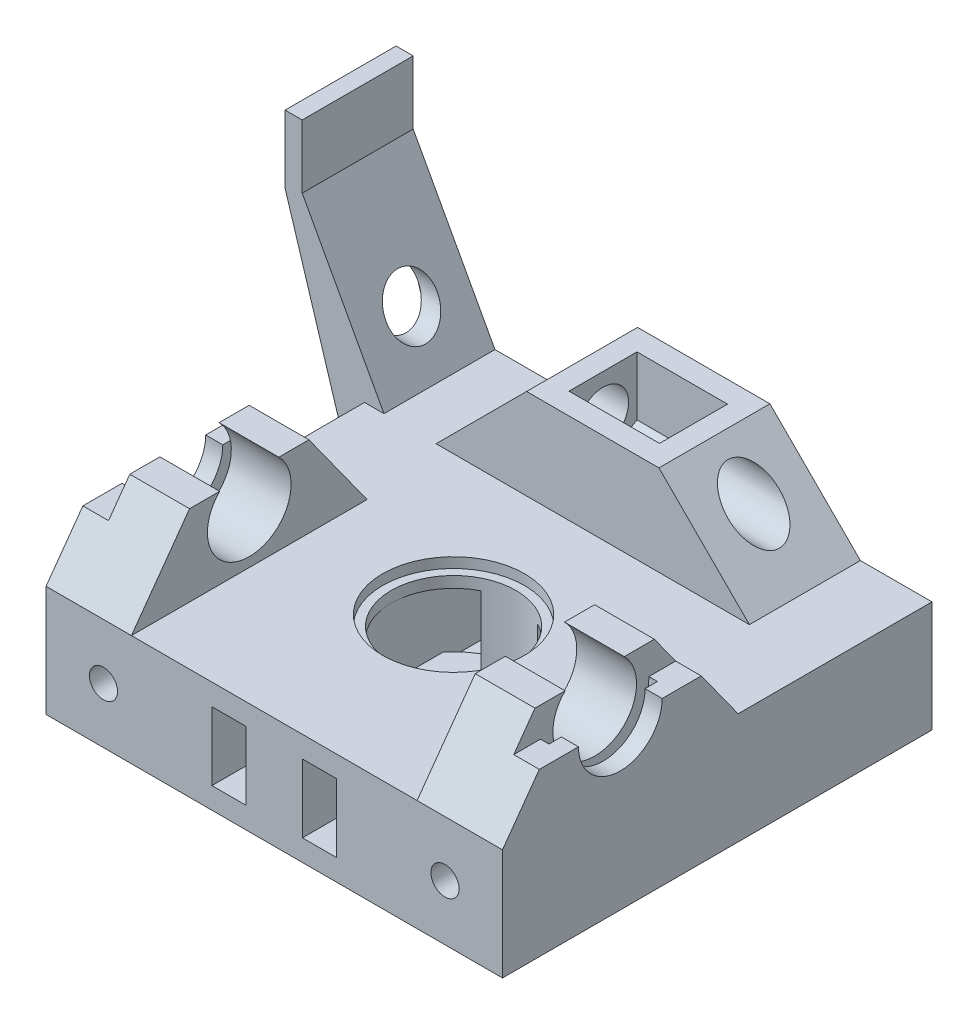
from build123d import *

# Parameters (mm, degrees)
SKETCH1_W           = 53.4573
SKETCH1_H           = 13
SKETCH1_R           = 4.2
BOSS_EXTRUDE1_DEPTH = 50.3
BOSS_EXTRUDE2_START = -15
SKETCH3_R           = 4.2
BOSS_EXTRUDE2_DEPTH = 15
SKETCH8_W           = 15.5
SKETCH8_H           = 13
BOSS_EXTRUDE3_DEPTH = 10.6
CHAMFER1_SIZE       = 10.6
SKETCH5_R           = 3
SKETCH5_R_2         = 4
CUT_EXTRUDE1_DEPTH  = 76.366988286
CUT_EXTRUDE2_DEPTH  = 5.3
BOSS_EXTRUDE4_DEPTH = 10
CUT_EXTRUDE3_DEPTH  = 1
SKETCH13_W          = 21.695080859
SKETCH13_H          = 9.09610943
CUT_EXTRUDE4_DEPTH  = 3
SKETCH16_R          = 1.65
CUT_EXTRUDE5_DEPTH  = 59.425257644
SKETCH17_R          = 7.3
CUT_EXTRUDE6_DEPTH  = 10.5
SKETCH15_W          = 4
SKETCH15_H          = 8
CUT_EXTRUDE7_DEPTH  = 60.472016368
SKETCH18_R          = 8.3
CUT_EXTRUDE8_DEPTH  = 1.2
SKETCH21_R          = 1.65
CUT_EXTRUDE9_DEPTH  = 60.472016368
CUT_EXTRUDE10_DEPTH = 2.6
CUT_EXTRUDE11_START = -1
CUT_EXTRUDE11_DEPTH = 10
BOSS_EXTRUDE5_DEPTH = 13
CUT_EXTRUDE12_START = 10
SKETCH27_R          = 3
CUT_EXTRUDE12_DEPTH = 10
BOSS_EXTRUDE7_DEPTH = 1.5
CUT_EXTRUDE13_REACH = 81.875
CHAMFER2_SIZE       = 0.5


# Read off the part's stored shape, not the designer's step: Cut-Extrude11
with BuildPart() as part:
    # Sketch1 → Boss-Extrude1 (new body)
    with BuildSketch(Plane.XY):
        Rectangle(SKETCH1_W, SKETCH1_H)
        with Locations(Location((-20, 0, 0), (0, 0, 180))):
            Circle(SKETCH1_R, mode=Mode.SUBTRACT)
        with Locations(Location((20, 0, 0), (0, 0, 180))):
            Circle(SKETCH1_R, mode=Mode.SUBTRACT)
    extrude(amount=BOSS_EXTRUDE1_DEPTH)

    # Sketch3 → Boss-Extrude2 (add)
    with BuildSketch(Plane.XY.offset(50.3).offset(BOSS_EXTRUDE2_START)):
        with Locations(Location((-20, 0, 0), (0, 0, 180))):
            Circle(SKETCH3_R)
        with Locations(Location((20, 0, 0), (0, 0, 180))):
            Circle(SKETCH3_R)
    extrude(amount=BOSS_EXTRUDE2_DEPTH)

    # Sketch8 → Boss-Extrude3 (add)
    with BuildSketch(Plane(origin=(0, 6.5, 0), x_dir=(1, 0, 0), z_dir=(0, 1, 0))):
        with Locations((0, -6.5)):
            Rectangle(SKETCH8_W, SKETCH8_H)
    extrude(amount=BOSS_EXTRUDE3_DEPTH)

    # Chamfer1
    chamfer1_edges = [part.edges().sort_by_distance(p)[0] for p in [
        (7.75, 6.5, 6.5),
        (-7.75, 6.5, 6.5),
    ]]
    chamfer(chamfer1_edges, length=CHAMFER1_SIZE - 0.0001)  # a hair under: the kernel refuses the full size

    # Sketch5 → Cut-Extrude1 (cut, through all)
    with BuildSketch(Plane.ZY.offset(26.72865)):
        with Locations(Location((6.5, 12.5, 0), (0, 0, 270))):
            Circle(SKETCH5_R)
        with Locations((36.5, 12.5)):
            Circle(SKETCH5_R_2)
    extrude(amount=-CUT_EXTRUDE1_DEPTH, mode=Mode.SUBTRACT)

    # Sketch10 → Cut-Extrude2 (cut)
    with BuildSketch(Plane.ZY):
        Polygon((2.516283143, 14.8), (2.516283143, 17.1), (10.483716857, 17.1), (10.483716857, 14.8), (10.483716857, 10.2), (6.5, 7.9), (2.516283143, 10.2), align=None)
    cut_extrude2 = extrude(amount=-CUT_EXTRUDE2_DEPTH, mode=Mode.SUBTRACT)

    # Mirror1: Cut-Extrude2 across plane
    add(cut_extrude2.mirror(Plane.ZY), mode=Mode.SUBTRACT)

    # Sketch11 → Boss-Extrude4 (add)
    with BuildSketch(Plane.ZY.offset(26.72865)):
        with BuildLine():
            Line((33.035176772, 15.964823228), (29.509293572, 15.964823228))
            Line((29.509293572, 15.964823228), (22.7, 6.5))
            Line((22.7, 6.5), (50.3, 6.5))
            Line((50.3, 6.5), (43.490706428, 15.964823228))
            Line((43.490706428, 15.964823228), (39.964823228, 15.964823228))
            ThreePointArc((39.964823228, 15.964823228), (36.5, 7.6), (33.035176772, 15.964823228))
        make_face()
    boss_extrude4 = extrude(amount=-BOSS_EXTRUDE4_DEPTH)

    # Sketch12 → Cut-Extrude3 (cut)
    with BuildSketch(Plane.ZY.offset(24.72865)):
        with BuildLine():
            Line((30.15, 12.5), (30.15, 21.960655534))
            Line((30.15, 21.960655534), (42.85, 21.960655534))
            Line((42.85, 21.960655534), (42.85, 12.5))
            ThreePointArc((42.85, 12.5), (36.5, 6.15), (30.15, 12.5))
        make_face()
    cut_extrude3 = extrude(amount=-CUT_EXTRUDE3_DEPTH, mode=Mode.SUBTRACT)

    # Sketch13 → Cut-Extrude4 (cut)
    with BuildSketch(Plane.ZY.offset(26.72865)):
        with Locations((35.453328021, 17.048054715)):
            Rectangle(SKETCH13_W, SKETCH13_H)
    cut_extrude4 = extrude(amount=-CUT_EXTRUDE4_DEPTH, mode=Mode.SUBTRACT)

    # Mirror2: Boss-Extrude4, Cut-Extrude3, Cut-Extrude4 across plane
    add(boss_extrude4.mirror(Plane.ZY))
    add(cut_extrude3.mirror(Plane.ZY), mode=Mode.SUBTRACT)
    add(cut_extrude4.mirror(Plane.ZY), mode=Mode.SUBTRACT)

    # Sketch16 → Cut-Extrude5 (cut, through all)
    with BuildSketch(Plane(origin=(0, 6.5, 0), x_dir=(1, 0, 0), z_dir=(0, 1, 0))):
        with Locations(Location((0, -29.3, 0), (0, 0, 180))):
            Circle(SKETCH16_R)
    extrude(amount=-CUT_EXTRUDE5_DEPTH, mode=Mode.SUBTRACT)

    # Sketch17 → Cut-Extrude6 (cut)
    with BuildSketch(Plane(origin=(0, 6.5, 0), x_dir=(1, 0, 0), z_dir=(0, 1, 0))):
        with Locations(Location((0, -29.3, 0), (0, 0, 180))):
            Circle(SKETCH17_R)
    extrude(amount=-CUT_EXTRUDE6_DEPTH, mode=Mode.SUBTRACT)

    # Sketch15 → Cut-Extrude7 (cut, through all)
    with BuildSketch(Plane(origin=(0, 0, 0), x_dir=(-1, 0, 0), z_dir=(0, 0, -1))):
        with Locations((-5.3, 0)):
            Rectangle(SKETCH15_W, SKETCH15_H)
    cut_extrude7 = extrude(amount=-CUT_EXTRUDE7_DEPTH, mode=Mode.SUBTRACT)

    # Mirror3: Cut-Extrude7 across plane
    add(cut_extrude7.mirror(Plane.ZY), mode=Mode.SUBTRACT)

    # Sketch18 → Cut-Extrude8 (cut)
    with BuildSketch(Plane(origin=(0, 6.5, 0), x_dir=(1, 0, 0), z_dir=(0, 1, 0))):
        with Locations(Location((0, -29.3, 0), (0, 0, 180))):
            Circle(SKETCH18_R)
    extrude(amount=-CUT_EXTRUDE8_DEPTH, mode=Mode.SUBTRACT)

    # Sketch20 → Revolve1 (revolve)
    with BuildSketch(Plane.ZY, mode=Mode.PRIVATE) as revolve1_sk:
        Polygon((30.95, -4), (30.95, -2), (31.95, -2), (33.95, -4), align=None)
    revolve(revolve1_sk.sketch.rotate(Axis((0, -4, 29.3), (0, 1, 0)), 270), axis=Axis((0, -4, 29.3), (0, 1, 0)))

    # Sketch21 → Cut-Extrude9 (cut, through all)
    with BuildSketch(Plane.XY.offset(50.3)):
        with Locations((20, 0)):
            Circle(SKETCH21_R)
        with Locations((-20, 0)):
            Circle(SKETCH21_R)
    extrude(amount=-CUT_EXTRUDE9_DEPTH, mode=Mode.SUBTRACT)

    # Sketch22 → Cut-Extrude10 (cut)
    with BuildSketch(Plane.XY.offset(46.3)):
        Polygon((-22.901185103, 1.227039119), (-22.901185103, 2.802039119), (-17.098814897, 2.802039119), (-17.098814897, 1.413894196), (-17.098814897, -1.675), (-17.098814897, -7.277237341), (-22.901185103, -7.277237341), (-22.901185103, -1.675), align=None)
    cut_extrude10 = extrude(amount=-CUT_EXTRUDE10_DEPTH, mode=Mode.SUBTRACT)

    # Mirror4: Cut-Extrude10 across plane
    add(cut_extrude10.mirror(Plane.ZY), mode=Mode.SUBTRACT)

    # Cut-Extrude11 outline → Cut-Extrude11 (cut)
    with BuildSketch(Plane(origin=(0, -4, 0), x_dir=(1, 0, 0), z_dir=(0, 1, 0)).offset(CUT_EXTRUDE11_START)):
        with BuildLine():
            ThreePointArc((3.3, -20.391577019), (5.485502581, -21.543759839), (7.3, -23.220526339))
            Line((7.3, -23.220526339), (7.3, -2))
            Line((7.3, -2), (3.3, -2))
            Line((3.3, -2), (3.3, -20.391577019))
        make_face()
        with BuildLine():
            Line((-7.3, -2), (-7.3, -23.220526339))
            ThreePointArc((-7.3, -23.220526339), (-5.485502581, -21.543759839), (-3.3, -20.391577019))
            Line((-3.3, -20.391577019), (-3.3, -2))
            Line((-3.3, -2), (-7.3, -2))
        make_face()
    extrude(amount=CUT_EXTRUDE11_DEPTH, mode=Mode.SUBTRACT)

    # Sketch26 → Boss-Extrude5 (add)
    with BuildSketch(Plane(origin=(0, 0, 0), x_dir=(-1, 0, 0), z_dir=(0, 0, -1))):
        Polygon((24.4510146, 6.5), (26.72865, 6.5), (36.02865, 23.567646595), (36.02865, 31.5), (34.02865, 31.5), (34.02865, 24.077171637), align=None)
    extrude(amount=-BOSS_EXTRUDE5_DEPTH)

    # Sketch27 → Cut-Extrude12 (cut)
    with BuildSketch(Plane.ZY.offset(26.72865).offset(CUT_EXTRUDE12_START)):
        with Locations(Location((6.5, 12.5, 0), (0, 0, 270))):
            Circle(SKETCH27_R)
    extrude(amount=-CUT_EXTRUDE12_DEPTH, mode=Mode.SUBTRACT)

    # Sketch29 → Boss-Extrude7 (add)
    with BuildSketch(Plane(origin=(0, 0, 0), x_dir=(-1, 0, 0), z_dir=(0, 0, -1))):
        Polygon((26.72865, -6.5), (36.02865, 23.567646595), (26.72865, 6.5), align=None)
    boss_extrude7 = extrude(amount=-BOSS_EXTRUDE7_DEPTH)

    # Mirror5: Boss-Extrude7 across plane
    add(boss_extrude7.mirror(Plane(origin=(0, 0, 6.5), x_dir=(1, 0, 0), z_dir=(0, 0, -1))))

    # Sketch30 → Cut-Extrude13 (cut, up to next)
    with BuildSketch(Plane.ZY.offset(26.72865), mode=Mode.PRIVATE) as cut_extrude13_sk1:
        with BuildLine():
            Line((8.8848588, 10.679986675), (4.1151412, 10.679986675))
            ThreePointArc((4.1151412, 10.679986675), (6.5, 9.5), (8.8848588, 10.679986675))
        make_face()
    cut_extrude13_tool1 = extrude(cut_extrude13_sk1.sketch, amount=-CUT_EXTRUDE13_REACH, mode=Mode.PRIVATE) & part.part
    add(cut_extrude13_tool1.solids().sort_by_distance((-26.72865, 10.199004, 6.5))[0], mode=Mode.SUBTRACT)

    # Chamfer2
    chamfer2_edges = [part.edges().sort_by_distance(p)[0] for p in [
        (1.65, -6.5, 29.3),
        (-17.098814897, -6.5, 45),
        (-22.901185103, -6.5, 45),
        (-20, -6.5, 43.7),
        (-20, -6.5, 46.3),
        (22.901185103, -6.5, 45),
        (17.098814897, -6.5, 45),
        (20, -6.5, 43.7),
        (20, -6.5, 46.3),
    ]]
    chamfer(chamfer2_edges, length=CHAMFER2_SIZE)


solid = part.part
